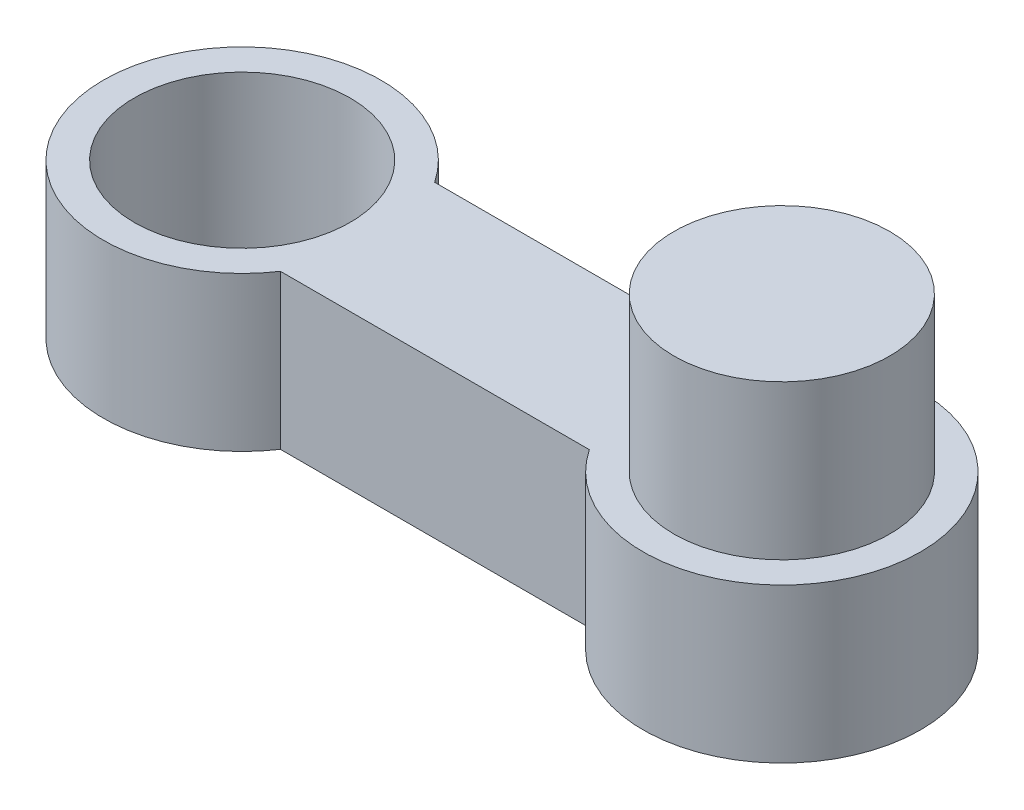
from build123d import *

# Parameters (mm, degrees)
BOSS_EXTRUDE1_DEPTH = 100
SKETCH2_R           = 70
CUT_EXTRUDE1_DEPTH  = 100
SKETCH3_R           = 70
BOSS_EXTRUDE2_DEPTH = 100


with BuildPart() as part:
    # Sketch1 → Boss-Extrude1 (new body)
    with BuildSketch(Plane(origin=(0, 0, 0), x_dir=(1, 0, 0), z_dir=(0, 1, 0))):
        with BuildLine():
            Line((-242.625717576, 275.741810419), (-242.625717576, 275.992438563))
            Line((-242.625717576, 275.992438563), (-42.625717576, 275.992438563))
            Line((-42.625717576, 275.992438563), (-42.625717576, 275.741810419))
            ThreePointArc((-42.625717576, 275.741810419), (122.374282424, 225.992438563), (-42.625717576, 176.243066708))
            Line((-42.625717576, 176.243066708), (-42.625717576, 175.992438563))
            Line((-42.625717576, 175.992438563), (-242.625717576, 175.992438563))
            Line((-242.625717576, 175.992438563), (-242.625717576, 176.243066708))
            ThreePointArc((-242.625717576, 176.243066708), (-407.625717576, 225.992438563), (-242.625717576, 275.741810419))
        make_face()
    extrude(amount=BOSS_EXTRUDE1_DEPTH)

    # Sketch2 → Cut-Extrude1 (cut)
    with BuildSketch(Plane(origin=(0, 100, 0), x_dir=(1, 0, 0), z_dir=(0, 1, 0))):
        with Locations((-317.625717576, 225.992438563)):
            Circle(SKETCH2_R)
    extrude(amount=-CUT_EXTRUDE1_DEPTH, mode=Mode.SUBTRACT)

    # Sketch3 → Boss-Extrude2 (add)
    with BuildSketch(Plane(origin=(0, 100, 0), x_dir=(1, 0, 0), z_dir=(0, 1, 0))):
        with Locations((32.374282424, 225.992438563)):
            Circle(SKETCH3_R)
    extrude(amount=BOSS_EXTRUDE2_DEPTH)


solid = part.part
